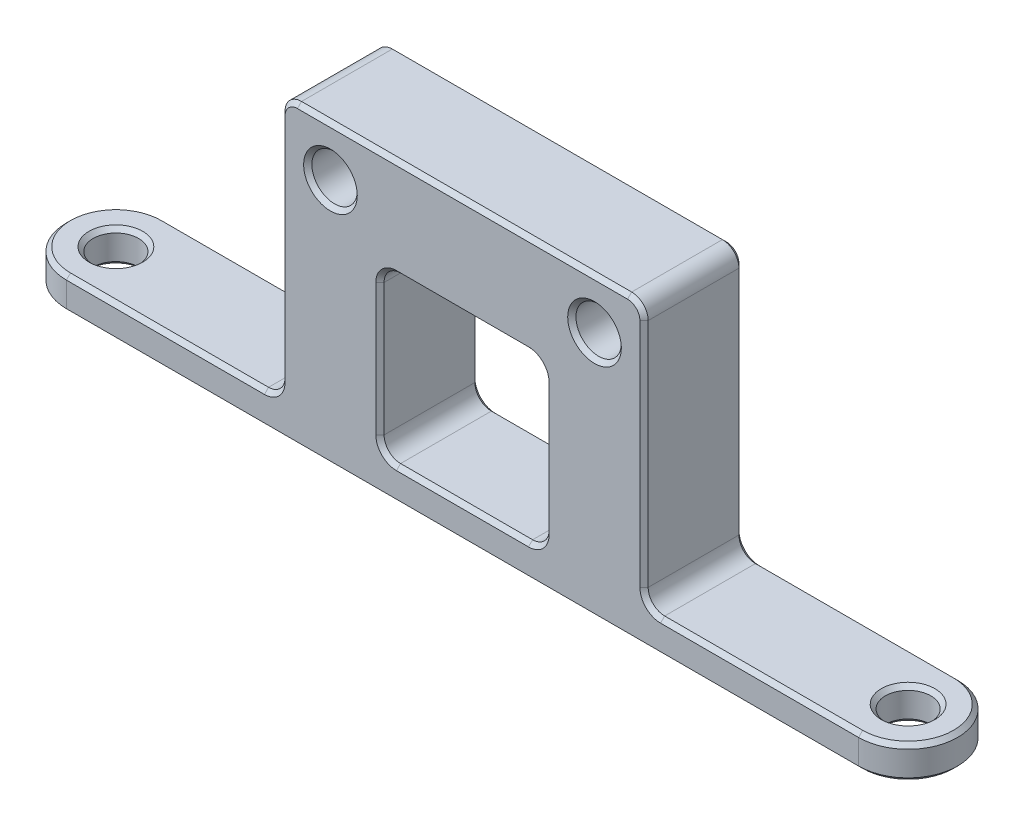
from build123d import *

# Parameters (mm, degrees)
SKETCH2_R               = 2.1828125
BOSS_EXTRUDE1_DEPTH     = 3.175
SKETCH3_W               = 36.843225838
SKETCH3_H               = 9.525
BOSS_EXTRUDE2_DEPTH     = 25.4
CUT_EXTRUDE1_DEPTH      = 53.3875
CUT_EXTRUDE1_DEPTH_BACK = 53.3875
SKETCH4_R               = 2.1828125
SKETCH4_W               = 0.959112919
SKETCH4_H               = 25.4
SKETCH4_W_2             = 15.875
SKETCH4_H_2             = 15.875
FILLET1_R               = 1.5875
CHAMFER1_SIZE           = 0.396875


with BuildPart() as part:
    # Sketch2 → Boss-Extrude1 (new body)
    with BuildSketch(Plane(origin=(0, 0, 0), x_dir=(1, 0, 0), z_dir=(0, 1, 0))):
        with BuildLine():
            Line((-38.1, 4.7625), (38.1, 4.7625))
            ThreePointArc((38.1, 4.7625), (42.8625, 0), (38.1, -4.7625))
            Line((38.1, -4.7625), (-38.1, -4.7625))
            ThreePointArc((-38.1, -4.7625), (-42.8625, 0), (-38.1, 4.7625))
        make_face()
        with Locations((-38.1, 0)):
            Circle(SKETCH2_R, mode=Mode.SUBTRACT)
        with Locations((38.1, 0)):
            Circle(SKETCH2_R, mode=Mode.SUBTRACT)
    extrude(amount=BOSS_EXTRUDE1_DEPTH)

    # Sketch3 → Boss-Extrude2 (add)
    with BuildSketch(Plane(origin=(0, 3.175, 0), x_dir=(1, 0, 0), z_dir=(0, 1, 0))):
        Rectangle(SKETCH3_W, SKETCH3_H)
    extrude(amount=BOSS_EXTRUDE2_DEPTH)

    # Sketch4 → Cut-Extrude1 (cut, two sides: drawn at the far end of the back side and taken through both)
    with BuildSketch(Plane.XY.offset(4.7625).offset(-CUT_EXTRUDE1_DEPTH_BACK)):
        with Locations((-12.7, 23.8125)):
            Circle(SKETCH4_R)
        with Locations((12.7, 23.8125)):
            Circle(SKETCH4_R)
        with Locations((-17.94205646, 15.875)):
            Rectangle(SKETCH4_W, SKETCH4_H)
        with Locations((17.94205646, 15.875)):
            Rectangle(SKETCH4_W, SKETCH4_H)
        with Locations((0, 11.1125)):
            Rectangle(SKETCH4_W_2, SKETCH4_H_2)
    extrude(amount=CUT_EXTRUDE1_DEPTH + CUT_EXTRUDE1_DEPTH_BACK, mode=Mode.SUBTRACT)

    # Fillet1
    fillet1_edges = [part.edges().sort_by_distance(p)[0] for p in [
        (-17.4625, 28.575, 0),
        (-17.4625, 3.175, 0),
        (17.4625, 28.575, 0),
        (17.4625, 3.175, 0),
        (-7.9375, 19.05, 0),
        (7.9375, 19.05, 0),
        (7.9375, 3.175, 0),
        (-7.9375, 3.175, 0),
    ]]
    fillet(fillet1_edges, radius=FILLET1_R)

    # Chamfer1
    chamfer1_edges = [part.edges().sort_by_distance(p)[0] for p in [
        (-14.8828125, 23.8125, 4.7625),
        (-14.8828125, 23.8125, -4.7625),
        (10.5171875, 23.8125, 4.7625),
        (10.5171875, 23.8125, -4.7625),
        (35.9171875, 3.175, 0),
        (-40.2828125, 3.175, 0),
        (0, 19.05, -4.7625),
        (-7.472532015, 18.585032015, -4.7625),
        (7.472532015, 18.585032015, -4.7625),
        (-7.9375, 11.1125, -4.7625),
        (7.9375, 11.1125, -4.7625),
        (-7.472532015, 3.639967985, -4.7625),
        (7.472532015, 3.639967985, -4.7625),
        (0, 3.175, -4.7625),
        (0, 19.05, 4.7625),
        (7.472532015, 18.585032015, 4.7625),
        (-7.472532015, 18.585032015, 4.7625),
        (7.9375, 11.1125, 4.7625),
        (-7.9375, 11.1125, 4.7625),
        (7.472532015, 3.639967985, 4.7625),
        (-7.472532015, 3.639967985, 4.7625),
        (0, 3.175, 4.7625),
        (35.9171875, 0, 0),
        (-40.2828125, 0, 0),
        (0, 0, 4.7625),
        (42.8625, 0, 0),
        (0, 0, -4.7625),
        (-42.8625, 0, 0),
        (0, 28.575, 4.7625),
        (16.997532015, 28.110032015, 4.7625),
        (-16.997532015, 28.110032015, 4.7625),
        (17.4625, 15.875, 4.7625),
        (-17.4625, 15.875, 4.7625),
        (17.927467985, 3.639967985, 4.7625),
        (-17.927467985, 3.639967985, 4.7625),
        (28.575, 3.175, 4.7625),
        (-28.575, 3.175, 4.7625),
        (42.8625, 3.175, 0),
        (-42.8625, 3.175, 0),
        (28.575, 3.175, -4.7625),
        (-28.575, 3.175, -4.7625),
        (17.927467985, 3.639967985, -4.7625),
        (-17.927467985, 3.639967985, -4.7625),
        (17.4625, 15.875, -4.7625),
        (-17.4625, 15.875, -4.7625),
        (16.997532015, 28.110032015, -4.7625),
        (-16.997532015, 28.110032015, -4.7625),
        (0, 28.575, -4.7625),
    ]]
    chamfer(chamfer1_edges, length=CHAMFER1_SIZE)


solid = part.part
